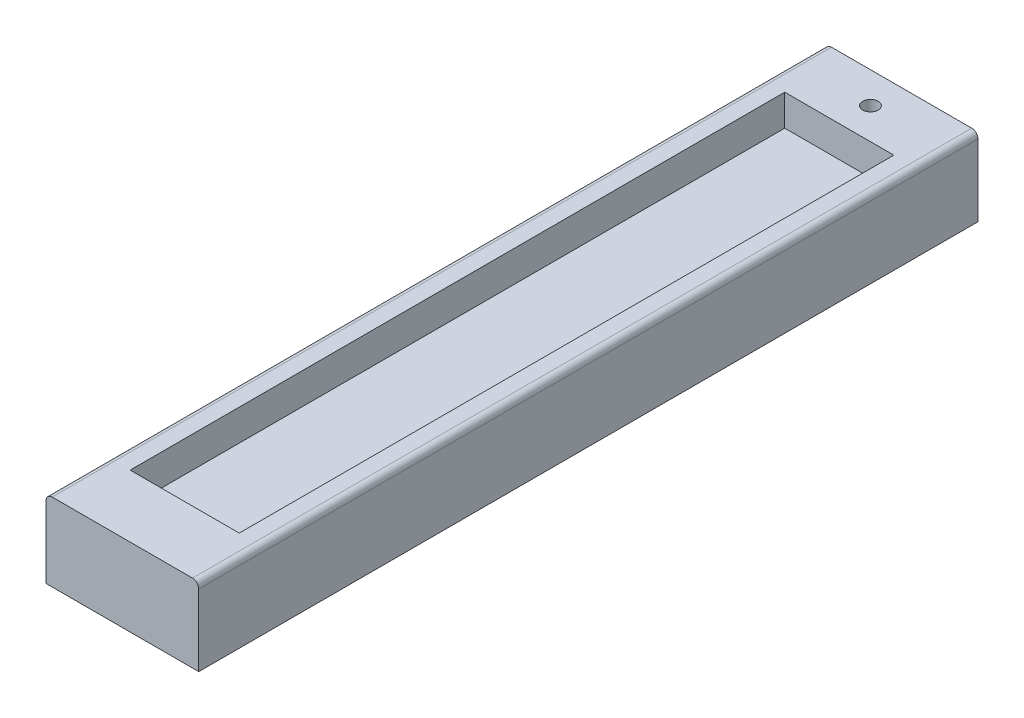
from build123d import *

# Parameters (mm, degrees)
SKETCH1_W               = 49
SKETCH1_H               = 20
BOSS_EXTRUDE1_DEPTH     = 125
SKETCH3_W               = 49
SKETCH3_H               = 250
BOSS_EXTRUDE2_DEPTH     = 5
CUT_EXTRUDE1_DEPTH      = 130.808512818
CUT_EXTRUDE1_DEPTH_BACK = 10
SKETCH2_R               = 2.46
SKETCH5_W               = 35
SKETCH5_H               = 210
CUT_EXTRUDE3_DEPTH      = 10
FILLET1_R               = 2
SKETCH4_R               = 7.874
CUT_EXTRUDE2_DEPTH      = 10


with BuildPart() as part:
    # Sketch1 → Boss-Extrude1 (new, symmetric)
    with BuildSketch(Plane.XY):
        Rectangle(SKETCH1_W, SKETCH1_H)
    extrude(amount=BOSS_EXTRUDE1_DEPTH, both=True)

    # Sketch3 → Boss-Extrude2 (add)
    with BuildSketch(Plane(origin=(0, 10, 0), x_dir=(1, 0, 0), z_dir=(0, 1, 0))):
        Rectangle(SKETCH3_W, SKETCH3_H)
    extrude(amount=BOSS_EXTRUDE2_DEPTH)

    # Sketch2 → Cut-Extrude1 (cut, two sides: drawn at the far end of the back side and taken through both)
    with BuildSketch(Plane(origin=(0, 15, 0), x_dir=(1, 0, 0), z_dir=(0, 1, 0)).offset(-CUT_EXTRUDE1_DEPTH_BACK)):
        with Locations((0, 115)):
            Circle(SKETCH2_R)
    extrude(amount=CUT_EXTRUDE1_DEPTH + CUT_EXTRUDE1_DEPTH_BACK, mode=Mode.SUBTRACT)

    # Sketch5 → Cut-Extrude3 (cut)
    with BuildSketch(Plane(origin=(0, 15, 0), x_dir=(1, 0, 0), z_dir=(0, 1, 0))):
        Rectangle(SKETCH5_W, SKETCH5_H)
    extrude(amount=-CUT_EXTRUDE3_DEPTH, mode=Mode.SUBTRACT)

    # Fillet1
    fillet1_edges = [part.edges().sort_by_distance(p)[0] for p in [
        (-24.5, 15, 0),
        (24.5, 15, 0),
    ]]
    fillet(fillet1_edges, radius=FILLET1_R)

    # Sketch4 → Cut-Extrude2 (cut)
    with BuildSketch(Plane.XZ.offset(10)):
        with Locations((-0.5, 110)):
            Circle(SKETCH4_R)
    extrude(amount=-CUT_EXTRUDE2_DEPTH, mode=Mode.SUBTRACT)


solid = part.part
